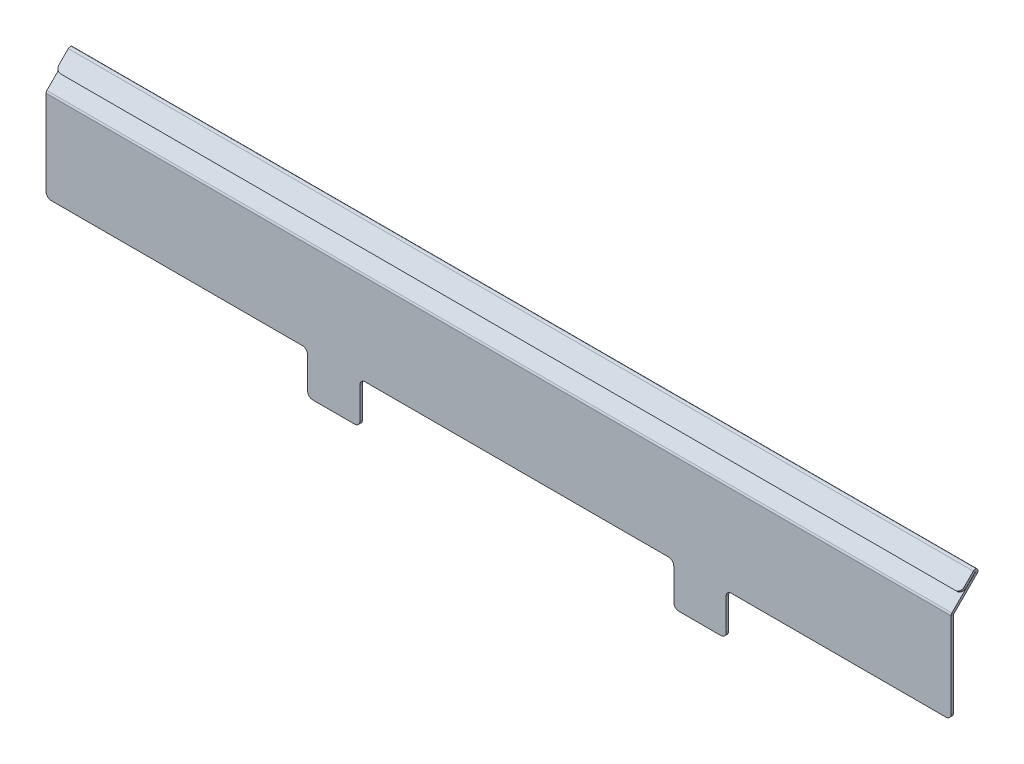
from build123d import *

# Parameters (mm, degrees)
BASIS_BLECH1_DEPTH              = 173
BLECHKANTENRAND1_START          = -173
BLECHKANTENRAND1_DEPTH          = 346
BLECHKANTENRAND1_2_DEPTH        = 346
VERRUNDUNG1_R                   = 2
SKIZZE19_W                      = 20
SKIZZE19_H                      = 1
AUFSATZ_LINEAR_AUSTRAGEN1_DEPTH = 16
VERRUNDUNG2_R                   = 2


# Read off the part's stored shape, not the designer's step: Blechkantenrand1
# Sheet-metal steps are written as plain solids
with BuildPart() as part:
    # Skizze1 → Basis-Blech1 (new, symmetric)
    with BuildSketch(Plane(origin=(0, 0, 0), x_dir=(0, 0, -1), z_dir=(1, 0, 0))):
        with BuildLine():
            Line((0, 0), (0, 34.544365081))
            ThreePointArc((0, 34.544365081), (0.083732514, 34.965316857), (0.322182541, 35.322182541))
            Line((0.322182541, 35.322182541), (10.040916293, 45.040916293))
            Line((10.040916293, 45.040916293), (10.748023074, 44.333809512))
            Line((10.748023074, 44.333809512), (1.029289322, 34.61507576))
            ThreePointArc((1.029289322, 34.61507576), (1.007612047, 34.582633425), (1, 34.544365081))
            Line((1, 34.544365081), (1, 0))
            Line((1, 0), (0, 0))
        make_face()
    extrude(amount=BASIS_BLECH1_DEPTH, both=True)

    # Blechkantenrand1 outline → Blechkantenrand1 (cut)
    with BuildSketch(Plane.YZ.offset(BLECHKANTENRAND1_START)):
        with BuildLine():
            Line((45.040916293, -10.040916293), (45.040074021, -10.040074021))
            ThreePointArc((45.040074021, -10.040074021), (44.308802418, -10.312801004), (43.591347391, -10.005560954))
            Line((43.591347391, -10.005560954), (44.333809512, -10.748023074))
            Line((44.333809512, -10.748023074), (45.040916293, -10.040916293))
        make_face()
    extrude(amount=BLECHKANTENRAND1_DEPTH, mode=Mode.SUBTRACT)

    # Blechkantenrand1 2 outline → Blechkantenrand1 2 (add)
    with BuildSketch(Plane.YZ.offset(BLECHKANTENRAND1_START)):
        with BuildLine():
            Line((40.161879503, -3.606244584), (39.454772721, -4.313351365))
            Line((39.454772721, -4.313351365), (44.369164851, -9.227743494))
            ThreePointArc((44.369164851, -9.227743494), (44.369164852, -9.298454172), (44.298454173, -9.298454173))
            Line((44.298454173, -9.298454173), (45.040074021, -10.040074021))
            ThreePointArc((45.040074021, -10.040074021), (45.383511682, -9.288105927), (45.076271632, -8.520636713))
            Line((45.076271632, -8.520636713), (40.161879503, -3.606244584))
        make_face()
    extrude(amount=BLECHKANTENRAND1_2_DEPTH)

    # Verrundung1
    verrundung1_edges = [part.edges().sort_by_distance(p)[0] for p in [
        (173, 0, -0.5),
        (-173, 39.808326112, -3.959797974),
        (173, 39.808326112, -3.959797974),
        (-173, 0, -0.5),
    ]]
    fillet(verrundung1_edges, radius=VERRUNDUNG1_R)

    # Skizze19 → Aufsatz-Linear austragen1 (add)
    with BuildSketch(Plane.XZ):
        with Locations((-63, -0.5)):
            Rectangle(SKIZZE19_W, SKIZZE19_H)
        with Locations((77, -0.5)):
            Rectangle(SKIZZE19_W, SKIZZE19_H)
    extrude(amount=AUFSATZ_LINEAR_AUSTRAGEN1_DEPTH)

    # Verrundung2
    verrundung2_edges = [part.edges().sort_by_distance(p)[0] for p in [
        (-73, 0, -0.5),
        (-53, 0, -0.5),
        (-73, -16, -0.5),
        (-53, -16, -0.5),
        (67, 0, -0.5),
        (87, 0, -0.5),
        (67, -16, -0.5),
        (87, -16, -0.5),
    ]]
    fillet(verrundung2_edges, radius=VERRUNDUNG2_R)


solid = part.part
